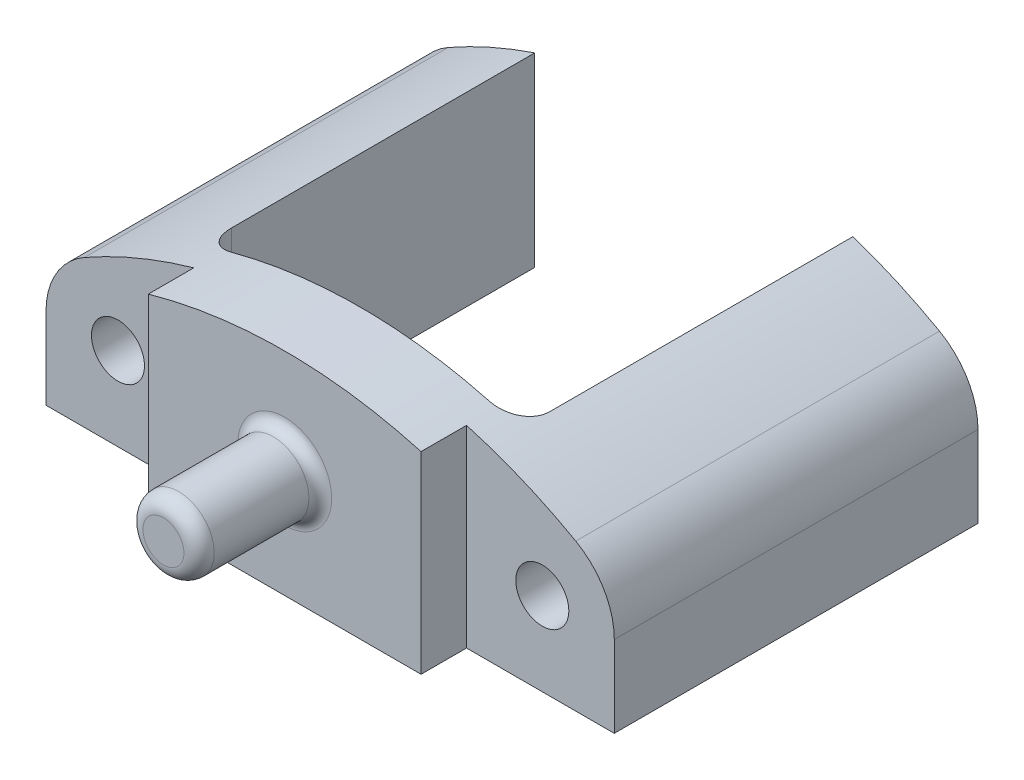
from build123d import *
from build123d.topology import SkipClean

# Parameters (mm, degrees)
SKETCH1_R               = 2.2225
BOSS_EXTRUDE1_DEPTH     = 6.35
SKETCH2_R               = 2.9845
BOSS_EXTRUDE2_DEPTH     = 10.16
FILLET1_R               = 1.27
FILLET2_R               = 0.9525
SKETCH3_R               = 6.35
CUT_EXTRUDE1_DEPTH      = 4.445
FILLET3_R               = 1.27
CUT_EXTRUDE3_DEPTH      = 3.81
BOSS_EXTRUDE3_START     = 27.94
SKETCH5_R               = 2.2225
BOSS_EXTRUDE3_DEPTH     = 27.94
FILLET4_R               = 2.54
CUT_EXTRUDE4_DEPTH      = 67.802633891
CUT_EXTRUDE4_DEPTH_BACK = 67.802633891
SKETCH6_R               = 48.008208045
SKETCH6_R_2             = 41.83530628
FILLET5_R               = 6.35


with BuildPart() as part:
    # Sketch1 → Boss-Extrude1 (new body)
    # profile 1 of 2: a face of its own
    with BuildSketch(Plane.XY):
        with BuildLine():
            ThreePointArc((0, 43.815), (-12.415069648, 42.019284509), (-23.8125, 36.779329368))
            Line((-23.8125, 36.779329368), (-23.8125, 24.079329368))
            Line((-23.8125, 24.079329368), (0, 24.079329368))
            Line((0, 24.079329368), (0, 43.815))
        make_face()
        with Locations((-17.78, 31.064329368)):
            Circle(SKETCH1_R, mode=Mode.SUBTRACT)
    # profile 2 of 2: a face of its own
    with BuildSketch(Plane.XY):
        with BuildLine():
            ThreePointArc((23.8125, 36.779329368), (12.415069648, 42.019284509), (0, 43.815))
            Line((0, 43.815), (0, 24.079329368))
            Line((0, 24.079329368), (23.8125, 24.079329368))
            Line((23.8125, 24.079329368), (23.8125, 36.779329368))
        make_face()
        with Locations((17.78, 31.064329368)):
            Circle(SKETCH1_R, mode=Mode.SUBTRACT)
    extrude(amount=BOSS_EXTRUDE1_DEPTH)

    # Sketch2 → Boss-Extrude2 (add)
    with BuildSketch(Plane.XY.offset(6.35)):
        with Locations((0, 33.096329368)):
            Circle(SKETCH2_R)
    extrude(amount=BOSS_EXTRUDE2_DEPTH)

    # Fillet1
    fillet1_edges = [part.edges().sort_by_distance(p)[0] for p in [
        (-2.9845, 33.096329368, 16.51),
    ]]
    fillet(fillet1_edges, radius=FILLET1_R)

    # Fillet2
    fillet2_edges = [part.edges().sort_by_distance(p)[0] for p in [
        (-2.9845, 33.096329368, 6.35),
    ]]
    fillet(fillet2_edges, radius=FILLET2_R)

    # Sketch3 → Cut-Extrude1 (cut)
    with BuildSketch(Plane(origin=(0, 0, 0), x_dir=(-1, 0, 0), z_dir=(0, 0, -1))):
        with Locations((0, 33.13540962)):
            Circle(SKETCH3_R)
    extrude(amount=-CUT_EXTRUDE1_DEPTH, mode=Mode.SUBTRACT)

    # Fillet3
    fillet3_edges = [part.edges().sort_by_distance(p)[0] for p in [
        (6.35, 33.13540962, 4.445),
        (6.35, 33.13540962, 0),
    ]]
    fillet(fillet3_edges, radius=FILLET3_R)

    # Sketch4 → Cut-Extrude3 (cut)
    with BuildSketch(Plane.XY.offset(6.35)):
        Polygon((-11.43, 43.00206802), (-28.337535583, 46.175596046), (-28.8894535, 24.714329368), (-14.712061992, 19.166112953), (-11.43, 21.94022116), align=None)
        Polygon((28.8894535, 24.714329368), (14.712061992, 19.166112953), (11.43, 21.94022116), (11.43, 31.064329368), (11.43, 43.00206802), (28.337535583, 46.175596046), align=None)
    extrude(amount=-CUT_EXTRUDE3_DEPTH, mode=Mode.SUBTRACT)

    # Sketch5 → Boss-Extrude3 (add)
    # profile 1 of 2: a face of its own
    with SkipClean():  # the faces are left unmerged after this step: merging them gives an invalid solid
        with BuildSketch(Plane(origin=(0, 0, 0), x_dir=(-1, 0, 0), z_dir=(0, 0, -1)).offset(BOSS_EXTRUDE3_START)):
            with BuildLine():
                Line((-13.335, 41.736458882), (-13.335, 24.079329368))
                Line((-13.335, 24.079329368), (-23.8125, 24.079329368))
                Line((-23.8125, 24.079329368), (-23.8125, 36.779329368))
                ThreePointArc((-23.8125, 36.779329368), (-18.738395671, 39.605892903), (-13.335, 41.736458882))
            make_face()
            with Locations((-17.78, 31.064329368)):
                Circle(SKETCH5_R, mode=Mode.SUBTRACT)
        # profile 2 of 2: a face of its own
        with BuildSketch(Plane(origin=(0, 0, 0), x_dir=(-1, 0, 0), z_dir=(0, 0, -1)).offset(BOSS_EXTRUDE3_START)):
            with BuildLine():
                Line((23.8125, 36.779329368), (23.8125, 24.079329368))
                Line((23.8125, 24.079329368), (13.335, 24.079329368))
                Line((13.335, 24.079329368), (13.335, 41.736458882))
                ThreePointArc((13.335, 41.736458882), (18.738395671, 39.605892903), (23.8125, 36.779329368))
            make_face()
            with Locations((17.78, 31.064329368)):
                Circle(SKETCH5_R, mode=Mode.SUBTRACT)
        extrude(amount=-BOSS_EXTRUDE3_DEPTH)

    # Fillet4
    # the kernel refuses this fillet: 2.54 mm, written as the material it adds along each edge
    with BuildSketch(Plane(origin=(13.335, 48.086458882, 0), x_dir=(-1, 0, 0), z_dir=(0, -1, 0))) as fillet4_piece_1_section:
        with BuildLine():
            CenterArc((FILLET4_R, FILLET4_R), FILLET4_R, 180, 90)
            Line((0, FILLET4_R), (0, 0))
            Line((0, 0), (FILLET4_R, 0))
        make_face()
    fillet4_piece_1 = extrude(amount=24.007129514, mode=Mode.PRIVATE)
    fillet4_piece_1 = fillet4_piece_1 & Plane(origin=(0, 0, -0.572064254), x_dir=(0, 1, 0), z_dir=(0, 0, -1)) * Cylinder(43.815, 59, mode=Mode.PRIVATE)
    add(fillet4_piece_1)
    with BuildSketch(Plane(origin=(-13.335, 24.079329368, 0), x_dir=(1, 0, 0), z_dir=(0, 1, 0))) as fillet4_piece_2_section:
        with BuildLine():
            CenterArc((FILLET4_R, FILLET4_R), FILLET4_R, 180, 90)
            Line((0, FILLET4_R), (0, 0))
            Line((0, 0), (FILLET4_R, 0))
        make_face()
    fillet4_piece_2 = extrude(amount=24.007129514, mode=Mode.PRIVATE)
    fillet4_piece_2 = fillet4_piece_2 & Plane(origin=(0, 0, -0.572062471), x_dir=(0, 1, 0), z_dir=(0, 0, -1)) * Cylinder(43.815, 59, mode=Mode.PRIVATE)
    add(fillet4_piece_2)

    # Sketch6 → Cut-Extrude4 (cut, two sides: drawn at the far end of the back side and taken through both)
    with BuildSketch(Plane(origin=(0, 0, -27.94), x_dir=(-1, 0, 0), z_dir=(0, 0, -1)).offset(-CUT_EXTRUDE4_DEPTH_BACK)):
        Circle(SKETCH6_R)
        Circle(SKETCH6_R_2, mode=Mode.SUBTRACT)
    extrude(amount=CUT_EXTRUDE4_DEPTH + CUT_EXTRUDE4_DEPTH_BACK, mode=Mode.SUBTRACT)

    # Fillet5
    fillet5_edges = [part.edges().sort_by_distance(p)[0] for p in [
        (23.8125, 34.397059399, -12.7),
        (-23.8125, 34.397059399, -12.7),
    ]]
    fillet(fillet5_edges, radius=FILLET5_R)


solid = part.part
